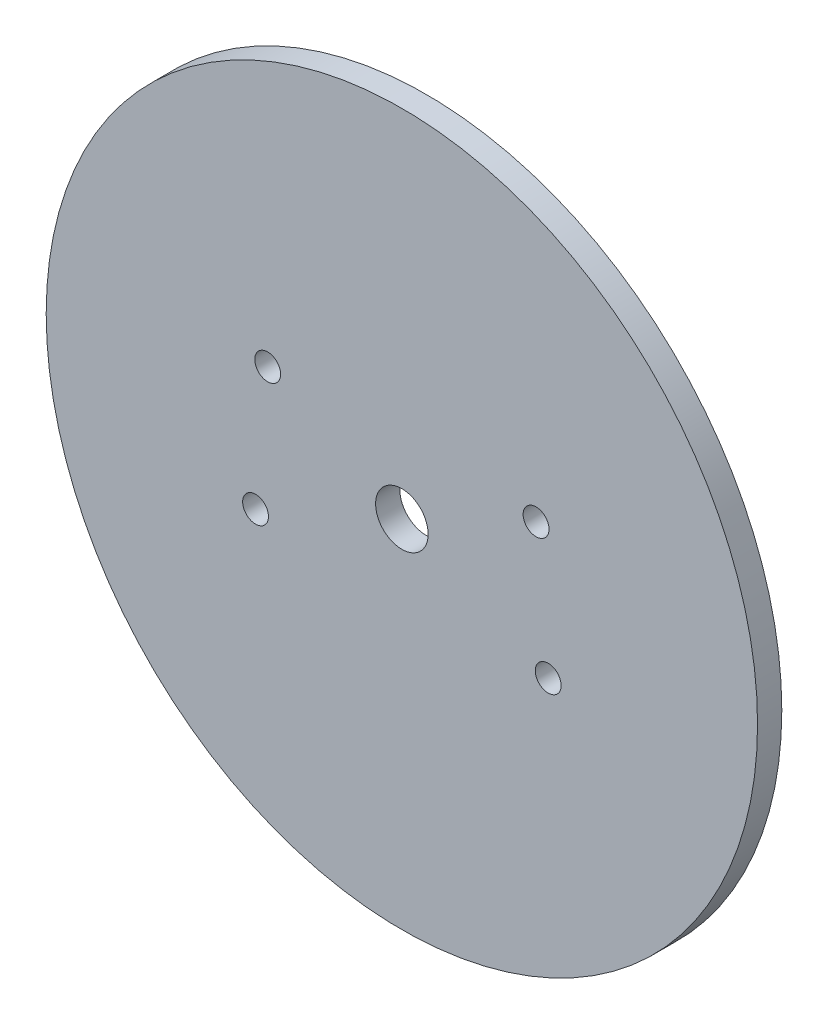
from build123d import *

# Parameters (mm, degrees)
SKETCH_1_R          = 44
EXTRUDE_1_DEPTH     = 3
SKETCH_2_R          = 1.6
CUT_EXTRUDE_1_DEPTH = 3
SKETCH_3_R          = 3.25
CUT_EXTRUDE_2_DEPTH = 35


with BuildPart() as part:
    # ｽｹｯﾁ1 → ﾎﾞｽ - 押し出し1 (new body)
    with BuildSketch(Plane.XY):
        Circle(SKETCH_1_R)
    extrude(amount=EXTRUDE_1_DEPTH)

    # ｽｹｯﾁ2 → ｶｯﾄ - 押し出し1 (cut)
    with BuildSketch(Plane.XY.offset(3)):
        with Locations((-16.6, 8)):
            Circle(SKETCH_2_R)
        with Locations((-18.1, -8)):
            Circle(SKETCH_2_R)
        with Locations((18.1, -8)):
            Circle(SKETCH_2_R)
        with Locations((16.6, 8)):
            Circle(SKETCH_2_R)
    extrude(amount=-CUT_EXTRUDE_1_DEPTH, mode=Mode.SUBTRACT)

    # ｽｹｯﾁ3 → ｶｯﾄ - 押し出し2 (cut)
    with BuildSketch(Plane.XY.offset(3)):
        Circle(SKETCH_3_R)
    extrude(amount=-CUT_EXTRUDE_2_DEPTH, mode=Mode.SUBTRACT)


solid = part.part
